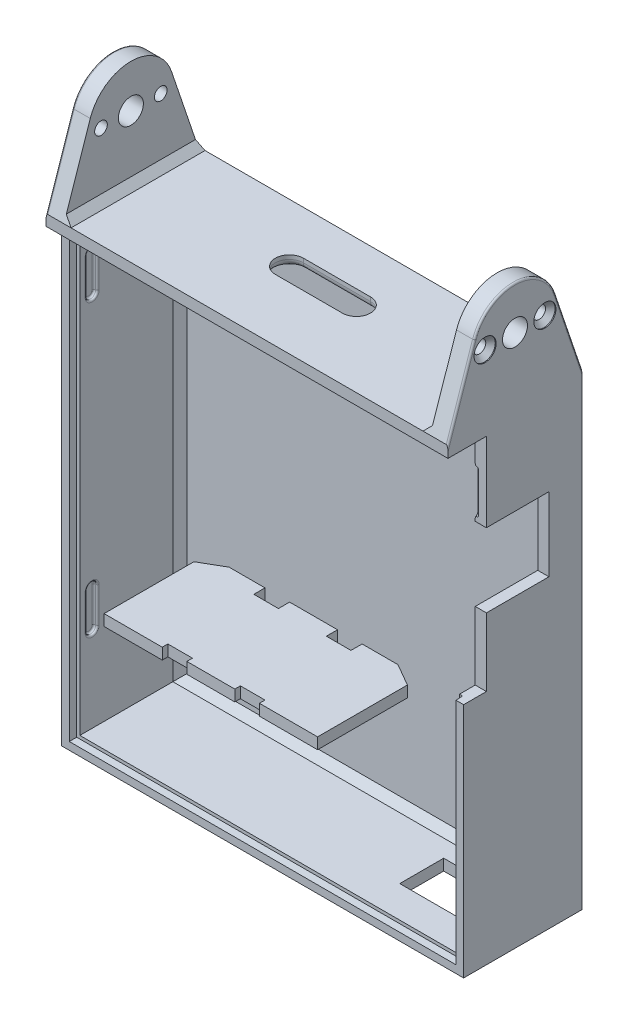
from build123d import *

# Parameters (mm, degrees)
BASESLICE_W             = 114.3
BASESLICE_H             = 38.1
BASE_DEPTH              = 3.175
SHELL_DEPTH             = 127
WHEELTABSLICE_W         = 5.08
WHEELTABSLICE_H         = 38.1
WHEELTAB_DEPTH          = 30.48
ROOFSLICE_W             = 114.3
ROOFSLICE_H             = 33.655
ROOF_DEPTH              = 3.175
WHEELTABSHAPE_DEPTH     = 175.278292256
MOTORHOLESSLICE_R       = 3.556
MOTORHOLESSLICE_R_2     = 1.5875
MOTORHOLES_DEPTH        = 175.278292256
CABLEPASSTHRU_REACH     = 145.438
CABLEPASSTHRUFILLET_R   = 2.032
MOTORHOLECSK_AT_2_COUNT = 2
MOTORHOLECSK_AT_2_PITCH = 17
WHEELTAB_FILLET_SIZE    = 2.032
EXTERNAL_FILLET_R       = 0.508
INTERNALCHAMFER_SIZE    = 2.032
SWITCHCUTOUT_REACH      = 176.555
SWITCHCUTOUTSLICE_W     = 19.0000128
SWITCHCUTOUTSLICE_H     = 12.499999892
BATTERYSHELFSLICE_W     = 60.706
BATTERYSHELFSLICE_H     = 3.175
BATTERYSHELF_DEPTH      = 29.21
BATTERYGRIP_REACH       = 144.967
BATTERYGRIPSLICE_W      = 7
BATTERYGRIPSLICE_H      = 3.175
BATTERYGRIPSLICE_H_2    = 1.5875
TAB_DEPTH               = 1
TABPATTERN_COUNT        = 2
TABPATTERN_PITCH        = 82.55
TABMIRROR_COPY_1_DEPTH  = 1
TABFILLET_R             = 0.5
ACCESSSLICE_W           = 12.686844675
ACCESSSLICE_H           = 62.865
BOARDACCESS_DEPTH       = 6.477
USBSLICE_W              = 3.175
USBSLICE_H              = 20.955
USBACCESS_DEPTH         = 17.78


with BuildPart() as part:
    # BaseSlice → Base (new body)
    with BuildSketch(Plane(origin=(0, 0, 0), x_dir=(1, 0, 0), z_dir=(0, 1, 0))):
        Rectangle(BASESLICE_W, BASESLICE_H)
    extrude(amount=BASE_DEPTH)

    # ShellSlice → Shell (add)
    with BuildSketch(Plane.XZ):
        Polygon((-57.15, 8.186722904), (-57.15, 14.605), (-53.975, 14.605), (-53.975, -15.875), (53.975, -15.875), (53.975, 14.605), (57.15, 14.605), (57.15, 8.186722904), (57.15, -19.05), (-57.15, -19.05), align=None)
    extrude(amount=SHELL_DEPTH)

    # WheelTabSlice → WheelTab (add)
    with BuildSketch(Plane(origin=(0, 3.175, 0), x_dir=(1, 0, 0), z_dir=(0, 1, 0))):
        with Locations((-54.61, 0)):
            Rectangle(WHEELTABSLICE_W, WHEELTABSLICE_H)
        with Locations((54.61, 0)):
            Rectangle(WHEELTABSLICE_W, WHEELTABSLICE_H)
    extrude(amount=WHEELTAB_DEPTH)

    # RoofSlice → Roof (add)
    with BuildSketch(Plane.XZ.offset(127)):
        with Locations((0, -2.2225)):
            Rectangle(ROOFSLICE_W, ROOFSLICE_H)
    extrude(amount=ROOF_DEPTH)

    # Groove: read off the stored shape, not the designer's step
    # Groove: loft between two sections, ruled curve by curve
    groove_from = [
        Edge.make_line((54.870184441, 0, 12.605), (54.870184441, -127.895184441, 12.605)),
        Edge.make_line((-54.870184441, -127.895184441, 12.605), (-54.870184441, 0, 12.605)),
        Edge.make_line((54.870184441, -127.895184441, 12.605), (-54.870184441, -127.895184441, 12.605)),
        Edge.make_line((-54.870184441, 0, 12.605), (54.870184441, 0, 12.605)),
    ]
    groove_to = [
        Edge.make_line((54.975, 0, 14.605), (54.975, -128, 14.605)),
        Edge.make_line((-54.975, -128, 14.605), (-54.975, 0, 14.605)),
        Edge.make_line((54.975, -128, 14.605), (-54.975, -128, 14.605)),
        Edge.make_line((-54.975, 0, 14.605), (54.975, 0, 14.605)),
    ]
    groove = Solid(Shell([*[Face.make_surface_from_curves(groove_from[k], groove_to[k]) for k in range(4)], Face(Wire(groove_from)), Face(Wire(groove_to))]))
    add(groove, mode=Mode.SUBTRACT)

    # WheelTabShapeSlice → WheelTabShape (cut, through all)
    with BuildSketch(Plane(origin=(57.15, 0, 0), x_dir=(0, 0, -1), z_dir=(1, 0, 0))):
        with BuildLine():
            Line((-4.8e-08, 33.655), (-19.05, 33.655))
            Line((-19.05, 33.655), (-19.05, 3.175))
            Line((-19.05, 3.175), (-11.558710059, 25.358360318))
            ThreePointArc((-11.558710059, 25.358360318), (-7.114035587, 31.366129989), (-4.8e-08, 33.655))
        make_face()
        with BuildLine():
            Line((19.05, 33.655), (-4.8e-08, 33.655))
            ThreePointArc((-4.8e-08, 33.655), (7.114035548, 31.366130017), (11.558710059, 25.358360318))
            Line((11.558710059, 25.358360318), (19.05, 3.175))
            Line((19.05, 3.175), (19.05, 33.655))
        make_face()
    extrude(amount=-WHEELTABSHAPE_DEPTH, mode=Mode.SUBTRACT)

    # MotorHolesSlice → MotorHoles (cut, through all)
    with BuildSketch(Plane.ZY.offset(57.15)):
        with Locations((0, 21.455)):
            Circle(MOTORHOLESSLICE_R)
        with Locations((-8.5, 21.455)):
            Circle(MOTORHOLESSLICE_R_2)
        with Locations((8.5, 21.455)):
            Circle(MOTORHOLESSLICE_R_2)
    extrude(amount=-MOTORHOLES_DEPTH, mode=Mode.SUBTRACT)

    # CablePassthroughSlice → CablePassthru (cut, up to next)
    with BuildSketch(Plane.XZ, mode=Mode.PRIVATE) as cablepassthru_sk1:
        with BuildLine():
            Line((-9.525, 1.46), (9.525, 1.46))
            ThreePointArc((9.525, 1.46), (13.525, -2.54), (9.525, -6.54))
            Line((9.525, -6.54), (-9.525, -6.54))
            ThreePointArc((-9.525, -6.54), (-13.525, -2.54), (-9.525, 1.46))
        make_face()
    cablepassthru_tool1 = extrude(cablepassthru_sk1.sketch, amount=-CABLEPASSTHRU_REACH, mode=Mode.PRIVATE) & part.part
    add(cablepassthru_tool1.solids().sort_by_distance((0, 0, -2.54))[0], mode=Mode.SUBTRACT)

    # CablePassthruFillet
    cablepassthrufillet_edges = [part.edges().sort_by_distance(p)[0] for p in [
        (-13.525, 0, -2.54),
        (0, 0, -6.54),
        (13.525, 0, -2.54),
        (0, 0, 1.46),
    ]]
    fillet(cablepassthrufillet_edges, radius=CABLEPASSTHRUFILLET_R)

    # Sketch15 → MotorHoleCsk (revolve, cut)
    with BuildSketch(Plane(origin=(-57.15, 21.455, -8.5), x_dir=(0, 0, 1), z_dir=(0, 1, 0))):
        Polygon((0, 0), (0, 114.3), (1.8, 114.3), (1.8, 1.604), (3.15, 0.254), (3.15, 0), align=None)
    motorholecsk = revolve(axis=Axis((-63.5, 21.455, -8.5), (1, 0, 0)), mode=Mode.SUBTRACT)

    # MotorHoleCsk at 2: MotorHoleCsk ×2
    with Locations(*[(0, 0, i * MOTORHOLECSK_AT_2_PITCH) for i in range(1, MOTORHOLECSK_AT_2_COUNT)]):
        add(motorholecsk, mode=Mode.SUBTRACT)

    # WheelTab Fillet
    wheeltab_fillet_edges = [part.edges().sort_by_distance(p)[0] for p in [
        (-52.07, 3.175, 0),
        (52.07, 3.175, 0),
    ]]
    chamfer(wheeltab_fillet_edges, length=WHEELTAB_FILLET_SIZE)

    # External Fillet
    external_fillet_edges = [part.edges().sort_by_distance(p)[0] for p in [
        (57.15, 14.266680159, 15.304355029),
        (57.15, 33.655, 0),
        (-57.15, 33.655, 0),
        (-57.15, 14.266680159, 15.304355029),
        (-57.15, 14.266680159, -15.304355029),
        (57.15, 14.266680159, -15.304355029),
    ]]
    fillet(external_fillet_edges, radius=EXTERNAL_FILLET_R)

    # InternalChamfer
    internalchamfer_edges = [part.edges().sort_by_distance(p)[0] for p in [
        (0, -127, -15.875),
        (53.975, -63.5, -15.875),
        (-53.975, -63.5, -15.875),
        (0, 0, -15.875),
    ]]
    chamfer(internalchamfer_edges, length=INTERNALCHAMFER_SIZE)

    # SwitchCutoutSlice → SwitchCutout (cut, up to next)
    with BuildSketch(Plane.XZ.offset(130.175), mode=Mode.PRIVATE) as switchcutout_sk1:
        with Locations((37.4899936, -2.640000054)):
            Rectangle(SWITCHCUTOUTSLICE_W, SWITCHCUTOUTSLICE_H)
    switchcutout_tool1 = extrude(switchcutout_sk1.sketch, amount=-SWITCHCUTOUT_REACH, mode=Mode.PRIVATE) & part.part
    add(switchcutout_tool1.solids().sort_by_distance((37.489994, -130.175, -2.64))[0], mode=Mode.SUBTRACT)

    # BatteryShelfSlice → BatteryShelf (add)
    with BuildSketch(Plane.XY.offset(-15.875)):
        with Locations((-16.002, -94.4125)):
            Rectangle(BATTERYSHELFSLICE_W, BATTERYSHELFSLICE_H)
    extrude(amount=BATTERYSHELF_DEPTH)

    # BatteryGripSlice → BatteryGrip (cut, up to next)
    with BuildSketch(Plane.XZ.offset(96), mode=Mode.PRIVATE) as batterygrip_sk1:
        Polygon((14.351, -12.208825791), (8.001, -15.875), (14.351, -15.875), align=None)
    batterygrip_tool1 = extrude(batterygrip_sk1.sketch, amount=-BATTERYGRIP_REACH, mode=Mode.PRIVATE) & part.part
    # BatteryGripSlice → BatteryGrip (cut, up to next)
    with BuildSketch(Plane.XZ.offset(96), mode=Mode.PRIVATE) as batterygrip_sk2:
        with Locations((-26.313158723, -14.2875)):
            Rectangle(BATTERYGRIPSLICE_W, BATTERYGRIPSLICE_H)
    batterygrip_tool2 = extrude(batterygrip_sk2.sketch, amount=-BATTERYGRIP_REACH, mode=Mode.PRIVATE) & part.part
    # BatteryGripSlice → BatteryGrip (cut, up to next)
    with BuildSketch(Plane.XZ.offset(96), mode=Mode.PRIVATE) as batterygrip_sk3:
        Polygon((-46.355, -15.875), (-40.005, -15.875), (-46.355, -12.208825791), align=None)
    batterygrip_tool3 = extrude(batterygrip_sk3.sketch, amount=-BATTERYGRIP_REACH, mode=Mode.PRIVATE) & part.part
    # BatteryGripSlice → BatteryGrip (cut, up to next)
    with BuildSketch(Plane.XZ.offset(96), mode=Mode.PRIVATE) as batterygrip_sk4:
        with Locations((-5.690841277, -14.2875)):
            Rectangle(BATTERYGRIPSLICE_W, BATTERYGRIPSLICE_H)
    batterygrip_tool4 = extrude(batterygrip_sk4.sketch, amount=-BATTERYGRIP_REACH, mode=Mode.PRIVATE) & part.part
    # BatteryGripSlice → BatteryGrip (cut, up to next)
    with BuildSketch(Plane.XZ.offset(96), mode=Mode.PRIVATE) as batterygrip_sk5:
        with Locations((-26.313158723, 12.54125)):
            Rectangle(BATTERYGRIPSLICE_W, BATTERYGRIPSLICE_H_2)
    batterygrip_tool5 = extrude(batterygrip_sk5.sketch, amount=-BATTERYGRIP_REACH, mode=Mode.PRIVATE) & part.part
    # BatteryGripSlice → BatteryGrip (cut, up to next)
    with BuildSketch(Plane.XZ.offset(96), mode=Mode.PRIVATE) as batterygrip_sk6:
        with Locations((-5.690841277, 12.54125)):
            Rectangle(BATTERYGRIPSLICE_W, BATTERYGRIPSLICE_H_2)
    batterygrip_tool6 = extrude(batterygrip_sk6.sketch, amount=-BATTERYGRIP_REACH, mode=Mode.PRIVATE) & part.part
    add(batterygrip_tool1.solids().sort_by_distance((12.234333, -96, -14.652942))[0], mode=Mode.SUBTRACT)
    add(batterygrip_tool2.solids().sort_by_distance((-26.313159, -96, -14.2875))[0], mode=Mode.SUBTRACT)
    add(batterygrip_tool3.solids().sort_by_distance((-44.238333, -96, -14.652942))[0], mode=Mode.SUBTRACT)
    add(batterygrip_tool4.solids().sort_by_distance((-5.690841, -96, -14.2875))[0], mode=Mode.SUBTRACT)
    add(batterygrip_tool5.solids().sort_by_distance((-26.313159, -96, 12.54125))[0], mode=Mode.SUBTRACT)
    add(batterygrip_tool6.solids().sort_by_distance((-5.690841, -96, 12.54125))[0], mode=Mode.SUBTRACT)

    # TabSlice → Tab (cut)
    with BuildSketch(Plane.ZY.offset(-53.975)):
        with BuildLine():
            Line((7.605, -20), (7.605, -10))
            ThreePointArc((7.605, -10), (9.105, -8.5), (10.605, -10))
            Line((10.605, -10), (10.605, -20))
            ThreePointArc((10.605, -20), (9.105, -21.5), (7.605, -20))
        make_face()
    tab = extrude(amount=-TAB_DEPTH, mode=Mode.SUBTRACT)

    # TabPattern: Tab ×2
    with Locations(*[(0, -i * TABPATTERN_PITCH, 0) for i in range(1, TABPATTERN_COUNT)]):
        add(tab, mode=Mode.SUBTRACT)

    # TabMirror: Tab across plane
    add(tab.mirror(Plane(origin=(0, 0, 0), x_dir=(0, 0, 1), z_dir=(1, 0, 0))), mode=Mode.SUBTRACT)

    # TabMirror copy 1 sketch → TabMirror copy 1 (cut)
    with BuildSketch(Plane(origin=(-53.975, -82.55, 0), x_dir=(0, 0, 1), z_dir=(1, 0, 0))):
        with BuildLine():
            Line((7.605, 20), (7.605, 10))
            ThreePointArc((7.605, 10), (9.105, 8.5), (10.605, 10))
            Line((10.605, 10), (10.605, 20))
            ThreePointArc((10.605, 20), (9.105, 21.5), (7.605, 20))
        make_face()
    extrude(amount=-TABMIRROR_COPY_1_DEPTH, mode=Mode.SUBTRACT)

    # TabFillet
    tabfillet_edges = [part.edges().sort_by_distance(p)[0] for p in [
        (53.975, -91.05, 9.105),
        (53.975, -97.55, 10.605),
        (53.975, -104.05, 9.105),
        (53.975, -97.55, 7.605),
        (53.975, -8.5, 9.105),
        (53.975, -21.5, 9.105),
        (53.975, -15, 10.605),
        (53.975, -15, 7.605),
        (54.975, -91.05, 9.105),
        (54.975, -97.55, 10.605),
        (54.975, -104.05, 9.105),
        (54.975, -8.5, 9.105),
        (54.975, -15, 10.605),
        (54.975, -21.5, 9.105),
        (54.975, -97.55, 7.605),
        (54.975, -15, 7.605),
        (-53.975, -8.5, 9.105),
        (-53.975, -15, 10.605),
        (-53.975, -21.5, 9.105),
        (-54.975, -8.5, 9.105),
        (-54.975, -15, 10.605),
        (-54.975, -21.5, 9.105),
        (-53.975, -91.05, 9.105),
        (-53.975, -97.55, 10.605),
        (-53.975, -104.05, 9.105),
        (-54.975, -91.05, 9.105),
        (-54.975, -97.55, 10.605),
        (-54.975, -104.05, 9.105),
        (-53.975, -15, 7.605),
        (-54.975, -15, 7.605),
        (-53.975, -97.55, 7.605),
        (-54.975, -97.55, 7.605),
    ]]
    fillet(tabfillet_edges, radius=TABFILLET_R - 0.0001)  # a hair under: the kernel refuses the full size

    # MotorHoleMirror: MotorHoleCsk across plane
    add(motorholecsk.mirror(Plane(origin=(0, 0, 0), x_dir=(0, 0, 1), z_dir=(1, 0, 0))), mode=Mode.SUBTRACT)

    # MotorHoleMirror copy 1 sketch → MotorHoleMirror copy 1 (revolve, cut)
    with BuildSketch(Plane(origin=(57.15, 21.455, 8.5), x_dir=(0, 0, 1), z_dir=(0, 1, 0))):
        Polygon((0, 0), (0, -114.3), (1.8, -114.3), (1.8, -1.604), (3.15, -0.254), (3.15, 0), align=None)
    revolve(axis=Axis((63.5, 21.455, 8.5), (1, 0, 0)), mode=Mode.SUBTRACT)

    # AccessSlice → BoardAccess (cut)
    with BuildSketch(Plane.XY.offset(14.605)):
        with Locations((50.806577663, -31.4325)):
            Rectangle(ACCESSSLICE_W, ACCESSSLICE_H)
    extrude(amount=-BOARDACCESS_DEPTH, mode=Mode.SUBTRACT)

    # UsbSlice → UsbAccess (cut)
    with BuildSketch(Plane.XY.offset(8.128)):
        with Locations((55.5625, -33.02)):
            Rectangle(USBSLICE_W, USBSLICE_H)
    extrude(amount=-USBACCESS_DEPTH, mode=Mode.SUBTRACT)


solid = part.part
